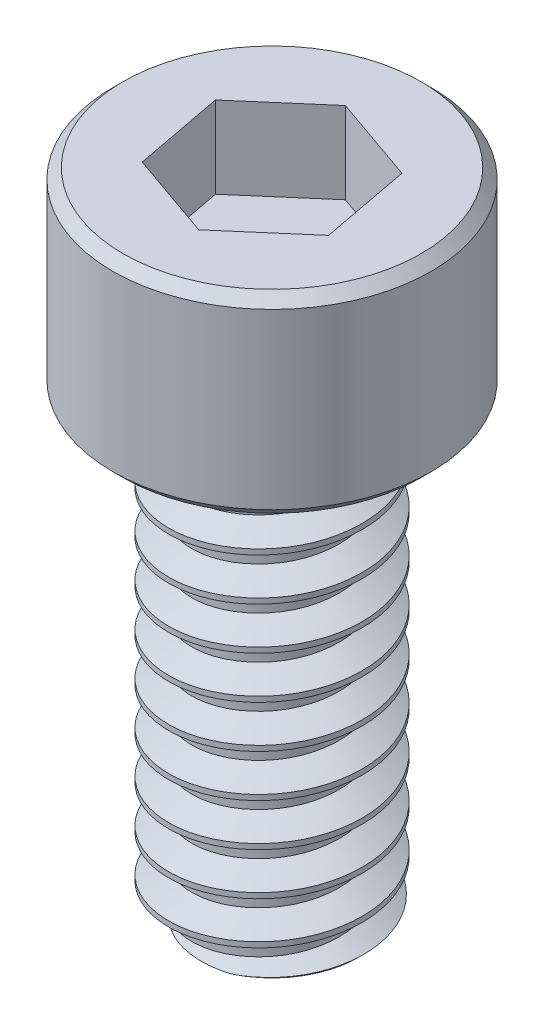
from build123d import *

# Parameters (mm, degrees)
SKETCH1_R           = 3.9624
BOSS_EXTRUDE1_DEPTH = 4.826
CUT_EXTRUDE1_DEPTH  = 2.032
SKETCH3_R           = 2.413
BOSS_EXTRUDE2_DEPTH = 11.1125
CHAMFER1_SIZE       = 0.254
THREAD1_PITCH       = 1.058333333


with BuildPart() as part:
    # Sketch1 → Boss-Extrude1 (new body)
    with BuildSketch(Plane(origin=(0, 0, 0), x_dir=(1, 0, 0), z_dir=(0, 1, 0))):
        with Locations(Location((0, 0, 0), (0, 0, 270))):
            Circle(SKETCH1_R)
    extrude(amount=BOSS_EXTRUDE1_DEPTH)

    # Sketch2 → Cut-Extrude1 (cut)
    with BuildSketch(Plane(origin=(0, 4.826, 0), x_dir=(1, 0, 0), z_dir=(0, 1, 0))):
        Polygon((1.73603296, 1.495498273), (-0.427123015, 2.251197781), (-2.163155975, 0.755699509), (-1.73603296, -1.495498273), (0.427123015, -2.251197781), (2.163155975, -0.755699509), align=None)
    extrude(amount=-CUT_EXTRUDE1_DEPTH, mode=Mode.SUBTRACT)

    # Sketch3 → Boss-Extrude2 (add)
    with BuildSketch(Plane.XZ):
        with Locations(Location((0, 0, 0), (0, 0, 90))):
            Circle(SKETCH3_R)
    extrude(amount=BOSS_EXTRUDE2_DEPTH)

    # Chamfer1
    chamfer1_edges = [part.edges().sort_by_distance(p)[0] for p in [
        (0, 0, -3.9624),
        (0, -11.1125, -2.413),
        (0, 4.826, -3.9624),
    ]]
    chamfer(chamfer1_edges, length=CHAMFER1_SIZE)

    # Thread1: the profile of Thread Profile1 profile screwed along a right-hand helix of 11.94 turns, 8 arcs to a turn; built about Z, then put on its axis
    thread1_z = Axis((0, 0, 0), (0, 0, 1))
    thread1_corners = [(2.4136, 0, -0.00034641), (2.4136, 0, 0.926388074), (1.840160282, 0, 0.595312499), (1.840160282, 0, 0.330729165)]
    with BuildLine(mode=Mode.PRIVATE) as thread1_profile:
        Line(thread1_corners[0], thread1_corners[1])
        Line(thread1_corners[1], thread1_corners[2])
        Line(thread1_corners[2], thread1_corners[3])
        Line(thread1_corners[3], thread1_corners[0])
    thread1_cap = Face(thread1_profile.wire())
    thread1_turn_angles = [0, 22.5, 45, 67.5, 90, 112.5, 135, 157.5, 180, 202.5, 225, 247.5, 270, 292.5, 315, 337.5, 360]
    thread1_turn_weights = [1, 0.9238795325112867, 1, 0.9238795325112867, 1, 0.9238795325112867, 1, 0.9238795325112867, 1, 0.9238795325112867, 1, 0.9238795325112867, 1, 0.9238795325112867, 1, 0.9238795325112867, 1]
    thread1_turn_rails = [Edge.make_bspline([Vector(p[0], p[1], 0).rotate(thread1_z, thread1_turn_angles[k]) / thread1_turn_weights[k] + Vector(0, 0, p[2] + THREAD1_PITCH * thread1_turn_angles[k] / 360) for k in range(17)], [0, 0, 0, 1, 1, 2, 2, 3, 3, 4, 4, 5, 5, 6, 6, 7, 7, 8, 8, 8], 2, thread1_turn_weights) for p in thread1_corners]
    thread1_turn_sides = [Face.make_surface_from_curves(thread1_turn_rails[p[0]], thread1_turn_rails[p[1]]) for p in [(0, 1), (1, 2), (2, 3), (3, 0)]]
    thread1_last_angles = [3960, 3982.5, 4005, 4027.5, 4050, 4072.5, 4095, 4117.5, 4140, 4162.5, 4185, 4207.5, 4230, 4252.5, 4275, 4286.7, 4298.4]
    thread1_last_weights = [1, 0.9238795325112867, 1, 0.9238795325112867, 1, 0.9238795325112867, 1, 0.9238795325112867, 1, 0.9238795325112867, 1, 0.9238795325112867, 1, 0.9238795325112867, 1, 0.9792228106217649, 1]
    thread1_last_rails = [Edge.make_bspline([Vector(p[0], p[1], 0).rotate(thread1_z, thread1_last_angles[k]) / thread1_last_weights[k] + Vector(0, 0, p[2] + THREAD1_PITCH * thread1_last_angles[k] / 360) for k in range(17)], [0, 0, 0, 1, 1, 2, 2, 3, 3, 4, 4, 5, 5, 6, 6, 7, 7, 8, 8, 8], 2, thread1_last_weights) for p in thread1_corners]
    thread1_last_sides = [Face.make_surface_from_curves(thread1_last_rails[p[0]], thread1_last_rails[p[1]]) for p in [(0, 1), (1, 2), (2, 3), (3, 0)]]
    thread1 = Plane(origin=(0, -12.1285, 0), x_dir=(1, 0, 0), z_dir=(0, 1, 0)) * Solid(Shell([*[p.moved(Location((0, 0, THREAD1_PITCH * i))) for i in range(11) for p in thread1_turn_sides], *thread1_last_sides, thread1_cap, thread1_cap.rotate(thread1_z, 4298.4).moved(Location((0, 0, THREAD1_PITCH * 4298.4 / 360)))]))
    add(thread1, mode=Mode.SUBTRACT)


solid = part.part
